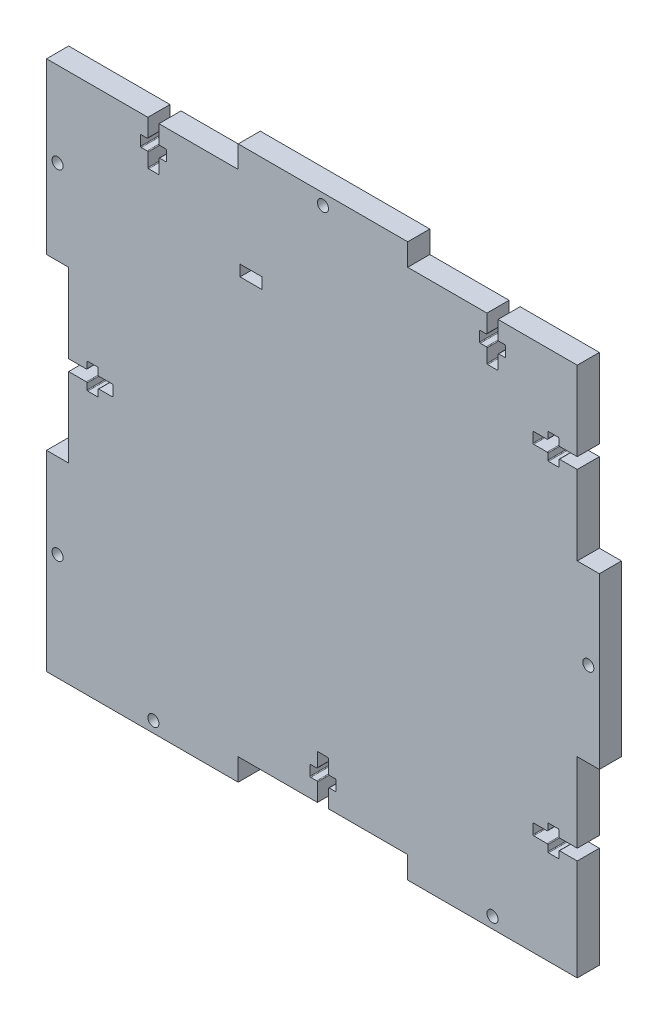
from build123d import *

# Parameters (mm, degrees)
BOX_SIDE_DEPTH       = 6
SKETCH2_R            = 1.5
SCREW_CUT_OUTS_DEPTH = 107.235587258
SKETCH3_W            = 6
SKETCH3_H            = 3
CUT_EXTRUDE1_DEPTH   = 107.235587258


with BuildPart() as part:
    # Sketch1 → Box Side (new body)
    with BuildSketch(Plane.XY):
        Polygon((-69, 69), (-23, 69), (-23, 75), (23, 75), (23, 69), (69, 69), (69, 23), (75, 23), (75, -23), (69, -23), (69, -69), (69, -75), (23, -75), (23, -69), (-23, -69), (-23, -75), (-69, -75), (-75, -75), (-75, -69), (-75, -23), (-69, -23), (-69, 23), (-75, 23), (-75, 69), align=None)
    extrude(amount=BOX_SIDE_DEPTH)

    # Sketch2 → Screw Cut-outs (cut, through all)
    with BuildSketch(Plane.XY.offset(6)):
        with Locations((0, 72)):
            Circle(SKETCH2_R)
        with Locations((72, 0)):
            Circle(SKETCH2_R)
        with Locations((-46, -72)):
            Circle(SKETCH2_R)
        with Locations((46, -72)):
            Circle(SKETCH2_R)
        with Locations((-72, 46)):
            Circle(SKETCH2_R)
        with Locations((-72, -46)):
            Circle(SKETCH2_R)
        with BuildLine():
            Line((-44.5, 69), (-44.5, 64.2))
            ThreePointArc((-44.5, 64.2), (-44.441421356, 64.058578644), (-44.3, 64))
            Line((-44.3, 64), (-42.7, 64))
            ThreePointArc((-42.7, 64), (-42.558578644, 63.941421356), (-42.5, 63.8))
            Line((-42.5, 63.8), (-42.5, 61.2))
            ThreePointArc((-42.5, 61.2), (-42.558578644, 61.058578644), (-42.7, 61))
            Line((-42.7, 61), (-44.3, 61))
            ThreePointArc((-44.3, 61), (-44.441421356, 60.941421356), (-44.5, 60.8))
            Line((-44.5, 60.8), (-44.5, 57.2))
            ThreePointArc((-44.5, 57.2), (-44.558578644, 57.058578644), (-44.7, 57))
            Line((-44.7, 57), (-47.3, 57))
            ThreePointArc((-47.3, 57), (-47.441421356, 57.058578644), (-47.5, 57.2))
            Line((-47.5, 57.2), (-47.5, 60.8))
            ThreePointArc((-47.5, 60.8), (-47.558578644, 60.941421356), (-47.7, 61))
            Line((-47.7, 61), (-49.3, 61))
            ThreePointArc((-49.3, 61), (-49.441421356, 61.058578644), (-49.5, 61.2))
            Line((-49.5, 61.2), (-49.5, 63.8))
            ThreePointArc((-49.5, 63.8), (-49.441421356, 63.941421356), (-49.3, 64))
            Line((-49.3, 64), (-47.7, 64))
            ThreePointArc((-47.7, 64), (-47.558578644, 64.058578644), (-47.5, 64.2))
            Line((-47.5, 64.2), (-47.5, 69))
            Line((-47.5, 69), (-44.5, 69))
        make_face()
        with BuildLine():
            Line((47.5, 69), (47.5, 64.2))
            ThreePointArc((47.5, 64.2), (47.558578644, 64.058578644), (47.7, 64))
            Line((47.7, 64), (49.3, 64))
            ThreePointArc((49.3, 64), (49.441421356, 63.941421356), (49.5, 63.8))
            Line((49.5, 63.8), (49.5, 61.2))
            ThreePointArc((49.5, 61.2), (49.441421356, 61.058578644), (49.3, 61))
            Line((49.3, 61), (47.7, 61))
            ThreePointArc((47.7, 61), (47.558578644, 60.941421356), (47.5, 60.8))
            Line((47.5, 60.8), (47.5, 57.2))
            ThreePointArc((47.5, 57.2), (47.441421356, 57.058578644), (47.3, 57))
            Line((47.3, 57), (44.7, 57))
            ThreePointArc((44.7, 57), (44.558578644, 57.058578644), (44.5, 57.2))
            Line((44.5, 57.2), (44.5, 60.8))
            ThreePointArc((44.5, 60.8), (44.441421356, 60.941421356), (44.3, 61))
            Line((44.3, 61), (42.7, 61))
            ThreePointArc((42.7, 61), (42.558578644, 61.058578644), (42.5, 61.2))
            Line((42.5, 61.2), (42.5, 63.8))
            ThreePointArc((42.5, 63.8), (42.558578644, 63.941421356), (42.7, 64))
            Line((42.7, 64), (44.3, 64))
            ThreePointArc((44.3, 64), (44.441421356, 64.058578644), (44.5, 64.2))
            Line((44.5, 64.2), (44.5, 69))
            Line((44.5, 69), (47.5, 69))
        make_face()
        with BuildLine():
            Line((69, 44.5), (64.2, 44.5))
            ThreePointArc((64.2, 44.5), (64.058578644, 44.441421356), (64, 44.3))
            Line((64, 44.3), (64, 42.7))
            ThreePointArc((64, 42.7), (63.941421356, 42.558578644), (63.8, 42.5))
            Line((63.8, 42.5), (61.2, 42.5))
            ThreePointArc((61.2, 42.5), (61.058578644, 42.558578644), (61, 42.7))
            Line((61, 42.7), (61, 44.3))
            ThreePointArc((61, 44.3), (60.941421356, 44.441421356), (60.8, 44.5))
            Line((60.8, 44.5), (57.2, 44.5))
            ThreePointArc((57.2, 44.5), (57.058578644, 44.558578644), (57, 44.7))
            Line((57, 44.7), (57, 47.3))
            ThreePointArc((57, 47.3), (57.058578644, 47.441421356), (57.2, 47.5))
            Line((57.2, 47.5), (60.8, 47.5))
            ThreePointArc((60.8, 47.5), (60.941421356, 47.558578644), (61, 47.7))
            Line((61, 47.7), (61, 49.3))
            ThreePointArc((61, 49.3), (61.058578644, 49.441421356), (61.2, 49.5))
            Line((61.2, 49.5), (63.8, 49.5))
            ThreePointArc((63.8, 49.5), (63.941421356, 49.441421356), (64, 49.3))
            Line((64, 49.3), (64, 47.7))
            ThreePointArc((64, 47.7), (64.058578644, 47.558578644), (64.2, 47.5))
            Line((64.2, 47.5), (69, 47.5))
            Line((69, 47.5), (69, 44.5))
        make_face()
        with BuildLine():
            Line((69, -47.5), (64.2, -47.5))
            ThreePointArc((64.2, -47.5), (64.058578644, -47.558578644), (64, -47.7))
            Line((64, -47.7), (64, -49.3))
            ThreePointArc((64, -49.3), (63.941421356, -49.441421356), (63.8, -49.5))
            Line((63.8, -49.5), (61.2, -49.5))
            ThreePointArc((61.2, -49.5), (61.058578644, -49.441421356), (61, -49.3))
            Line((61, -49.3), (61, -47.7))
            ThreePointArc((61, -47.7), (60.941421356, -47.558578644), (60.8, -47.5))
            Line((60.8, -47.5), (57.2, -47.5))
            ThreePointArc((57.2, -47.5), (57.058578644, -47.441421356), (57, -47.3))
            Line((57, -47.3), (57, -44.7))
            ThreePointArc((57, -44.7), (57.058578644, -44.558578644), (57.2, -44.5))
            Line((57.2, -44.5), (60.8, -44.5))
            ThreePointArc((60.8, -44.5), (60.941421356, -44.441421356), (61, -44.3))
            Line((61, -44.3), (61, -42.7))
            ThreePointArc((61, -42.7), (61.058578644, -42.558578644), (61.2, -42.5))
            Line((61.2, -42.5), (63.8, -42.5))
            ThreePointArc((63.8, -42.5), (63.941421356, -42.558578644), (64, -42.7))
            Line((64, -42.7), (64, -44.3))
            ThreePointArc((64, -44.3), (64.058578644, -44.441421356), (64.2, -44.5))
            Line((64.2, -44.5), (69, -44.5))
            Line((69, -44.5), (69, -47.5))
        make_face()
        with BuildLine():
            Line((-1.5, -69), (1.5, -69))
            Line((1.5, -69), (1.5, -64.2))
            ThreePointArc((1.5, -64.2), (1.558578644, -64.058578644), (1.7, -64))
            Line((1.7, -64), (3.3, -64))
            ThreePointArc((3.3, -64), (3.441421356, -63.941421356), (3.5, -63.8))
            Line((3.5, -63.8), (3.5, -61.2))
            ThreePointArc((3.5, -61.2), (3.441421356, -61.058578644), (3.3, -61))
            Line((3.3, -61), (1.7, -61))
            ThreePointArc((1.7, -61), (1.558578644, -60.941421356), (1.5, -60.8))
            Line((1.5, -60.8), (1.5, -57.2))
            ThreePointArc((1.5, -57.2), (1.441421356, -57.058578644), (1.3, -57))
            Line((1.3, -57), (-1.3, -57))
            ThreePointArc((-1.3, -57), (-1.441421356, -57.058578644), (-1.5, -57.2))
            Line((-1.5, -57.2), (-1.5, -60.8))
            ThreePointArc((-1.5, -60.8), (-1.558578644, -60.941421356), (-1.7, -61))
            Line((-1.7, -61), (-3.3, -61))
            ThreePointArc((-3.3, -61), (-3.441421356, -61.058578644), (-3.5, -61.2))
            Line((-3.5, -61.2), (-3.5, -63.8))
            ThreePointArc((-3.5, -63.8), (-3.441421356, -63.941421356), (-3.3, -64))
            Line((-3.3, -64), (-1.7, -64))
            ThreePointArc((-1.7, -64), (-1.558578644, -64.058578644), (-1.5, -64.2))
            Line((-1.5, -64.2), (-1.5, -69))
        make_face()
        with BuildLine():
            Line((-69, -1.5), (-64.2, -1.5))
            ThreePointArc((-64.2, -1.5), (-64.058578644, -1.558578644), (-64, -1.7))
            Line((-64, -1.7), (-64, -3.3))
            ThreePointArc((-64, -3.3), (-63.941421356, -3.441421356), (-63.8, -3.5))
            Line((-63.8, -3.5), (-61.2, -3.5))
            ThreePointArc((-61.2, -3.5), (-61.058578644, -3.441421356), (-61, -3.3))
            Line((-61, -3.3), (-61, -1.7))
            ThreePointArc((-61, -1.7), (-60.941421356, -1.558578644), (-60.8, -1.5))
            Line((-60.8, -1.5), (-57.2, -1.5))
            ThreePointArc((-57.2, -1.5), (-57.058578644, -1.441421356), (-57, -1.3))
            Line((-57, -1.3), (-57, 1.3))
            ThreePointArc((-57, 1.3), (-57.058578644, 1.441421356), (-57.2, 1.5))
            Line((-57.2, 1.5), (-60.8, 1.5))
            ThreePointArc((-60.8, 1.5), (-60.941421356, 1.558578644), (-61, 1.7))
            Line((-61, 1.7), (-61, 3.3))
            ThreePointArc((-61, 3.3), (-61.058578644, 3.441421356), (-61.2, 3.5))
            Line((-61.2, 3.5), (-63.8, 3.5))
            ThreePointArc((-63.8, 3.5), (-63.941421356, 3.441421356), (-64, 3.3))
            Line((-64, 3.3), (-64, 1.7))
            ThreePointArc((-64, 1.7), (-64.058578644, 1.558578644), (-64.2, 1.5))
            Line((-64.2, 1.5), (-69, 1.5))
            Line((-69, 1.5), (-69, -1.5))
        make_face()
    extrude(amount=-SCREW_CUT_OUTS_DEPTH, mode=Mode.SUBTRACT)

    # Sketch3 → Cut-Extrude1 (cut, through all)
    with BuildSketch(Plane.XY.offset(6)):
        with Locations((-19.5, 45.5)):
            Rectangle(SKETCH3_W, SKETCH3_H)
    extrude(amount=-CUT_EXTRUDE1_DEPTH, mode=Mode.SUBTRACT)


solid = part.part
